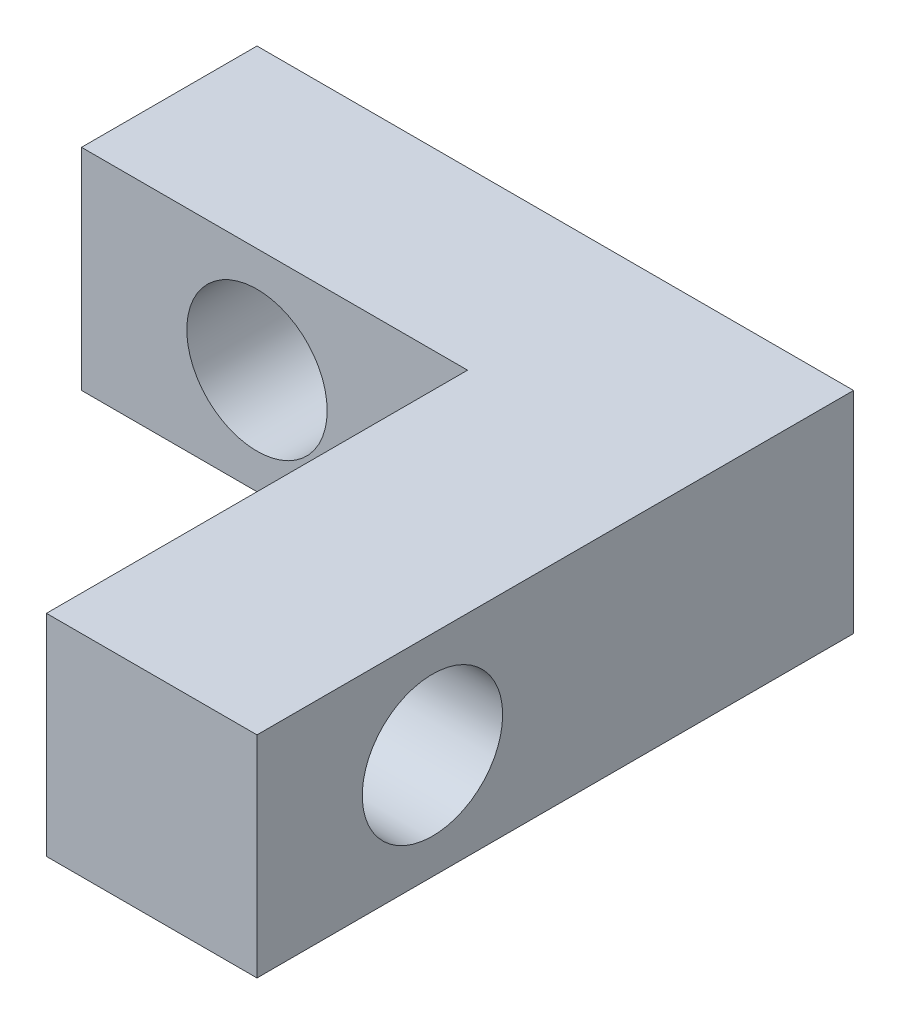
from build123d import *

# Parameters (mm, degrees)
ESQUISSE1_W             = 5.5
ESQUISSE1_H             = 3
ESQUISSE1_R             = 1
BOSS_EXTRU_1_DEPTH      = 2.5
ESQUISSE1_3_W           = 3
ESQUISSE1_3_H           = 3
BOSS_EXTRU_2_DEPTH      = 8.5
ENL_V_MAT_EXTRU_1_REACH = 14.114
ESQUISSE2_R             = 1


with BuildPart() as part:
    # Esquisse1 → Boss.-Extru.1 (new body)
    with BuildSketch(Plane.XY):
        with Locations((-1.5, 0)):
            Rectangle(ESQUISSE1_W, ESQUISSE1_H)
        with Locations((-1.75, 0)):
            Circle(ESQUISSE1_R, mode=Mode.SUBTRACT)
    extrude(amount=BOSS_EXTRU_1_DEPTH)

    # Esquisse1<3> → Boss.-Extru.2 (add)
    with BuildSketch(Plane.XY):
        with Locations((2.75, 0)):
            Rectangle(ESQUISSE1_3_W, ESQUISSE1_3_H)
    extrude(amount=BOSS_EXTRU_2_DEPTH)

    # Esquisse2 → Enlèv. mat.-Extru.1 (cut, up to next)
    with BuildSketch(Plane(origin=(4.25, 0, 0), x_dir=(0, 0, -1), z_dir=(1, 0, 0)), mode=Mode.PRIVATE) as enl_v_mat_extru_1_sk1:
        with Locations((-6, 0)):
            Circle(ESQUISSE2_R)
    enl_v_mat_extru_1_tool1 = extrude(enl_v_mat_extru_1_sk1.sketch, amount=-ENL_V_MAT_EXTRU_1_REACH, mode=Mode.PRIVATE) & part.part
    add(enl_v_mat_extru_1_tool1.solids().sort_by_distance((4.25, 0, 6))[0], mode=Mode.SUBTRACT)


solid = part.part
